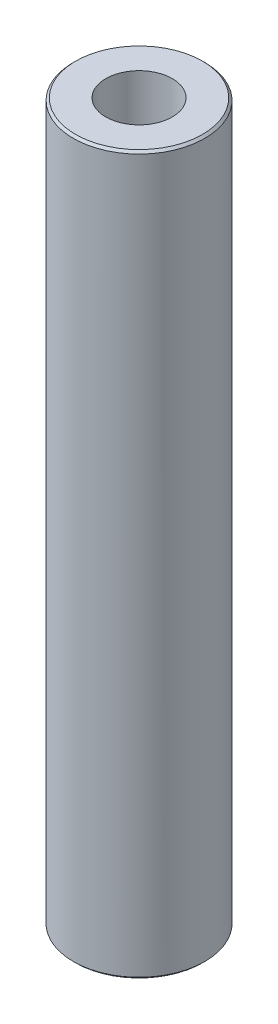
from build123d import *

# Parameters (mm, degrees)
SKETCH1_R           = 55
BOSS_EXTRUDE1_DEPTH = 600
SKETCH2_R           = 27.815956315
CUT_EXTRUDE1_DEPTH  = 606.020660804
CHAMFER1_SIZE       = 1.905565611


with BuildPart() as part:
    # Sketch1 → Boss-Extrude1 (new body)
    with BuildSketch(Plane(origin=(0, 0, 0), x_dir=(1, 0, 0), z_dir=(0, 1, 0))):
        Circle(SKETCH1_R)
    extrude(amount=BOSS_EXTRUDE1_DEPTH)

    # Sketch2 → Cut-Extrude1 (cut, through all)
    with BuildSketch(Plane(origin=(0, 0, 0), x_dir=(1, 0, 0), z_dir=(0, 1, 0))):
        Circle(SKETCH2_R)
    extrude(amount=CUT_EXTRUDE1_DEPTH, mode=Mode.SUBTRACT)

    # Chamfer1
    chamfer1_edges = [part.edges().sort_by_distance(p)[0] for p in [
        (-55, 600, 0),
        (-55, 0, 0),
    ]]
    chamfer(chamfer1_edges, length=CHAMFER1_SIZE)


solid = part.part
